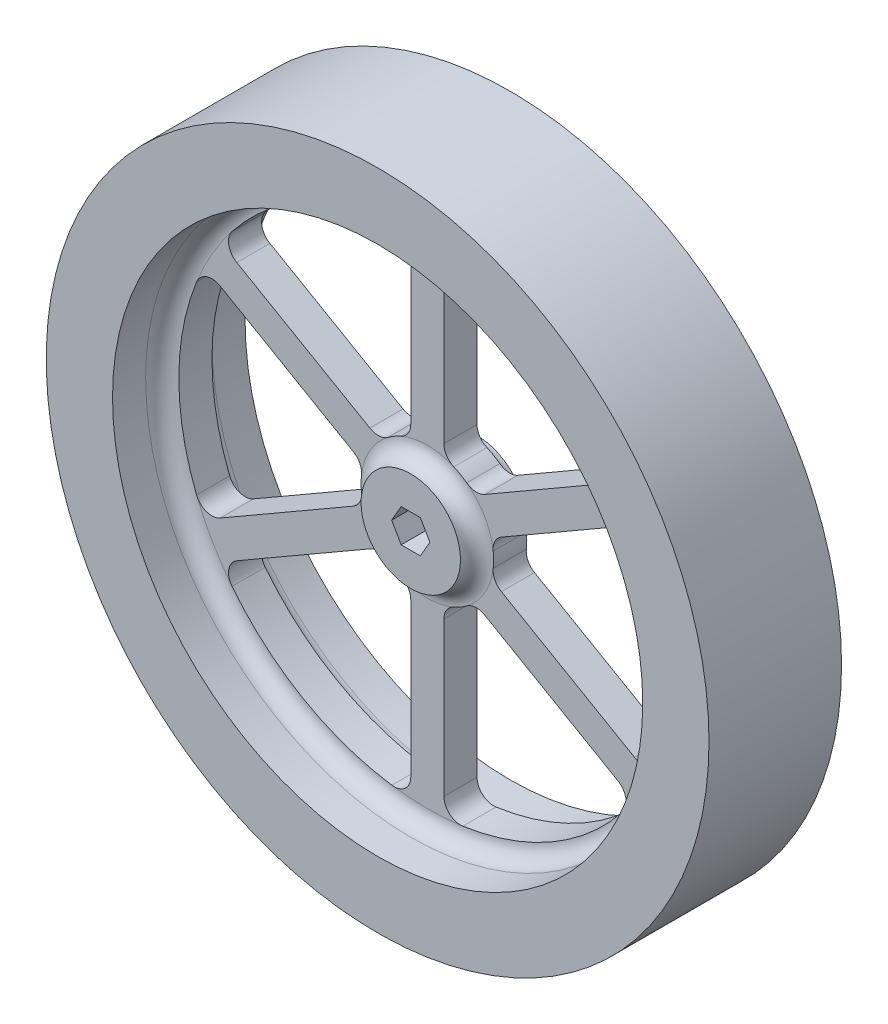
from build123d import *

# Parameters (mm, degrees)
BOSS_EXTRUDE1_DEPTH      = 25.4
BOSS_EXTRUDE1_DEPTH_BACK = 25.4
SKETCH1_R                = 127
SKETCH1_R_2              = 101.6
BOSS_EXTRUDE2_DEPTH      = 6.35
BOSS_EXTRUDE2_DEPTH_BACK = 6.35
SKETCH1_4_R              = 101.6
SKETCH1_4_R_2            = 95.25
SKETCH1_4_R_3            = 25.4
SKETCH1_4_R_4            = 19.05
BOSS_EXTRUDE3_DEPTH      = 12.7
BOSS_EXTRUDE3_DEPTH_BACK = 12.7
SKETCH1_5_R              = 19.05
BOSS_EXTRUDE4_DEPTH      = 6.35
FILLET1_R                = 6.35
CIRPATTERN2_START        = -6.35
CIRPATTERN2_DEPTH        = 12.7


with BuildPart() as part:
    # Sketch1 → Boss-Extrude1 (new, two sides: drawn at the far end of the back side and taken through both)
    with BuildSketch(Plane.XY.offset(-BOSS_EXTRUDE1_DEPTH_BACK)):
        Circle(SKETCH1_R)
        Circle(SKETCH1_R_2, mode=Mode.SUBTRACT)
    extrude(amount=BOSS_EXTRUDE1_DEPTH + BOSS_EXTRUDE1_DEPTH_BACK)

    # Sketch1<4> → Boss-Extrude2 (add, two sides: drawn at the far end of the back side and taken through both)
    # profile 1 of 2: a face of its own
    with BuildSketch(Plane.XY.offset(-BOSS_EXTRUDE2_DEPTH_BACK)):
        Circle(SKETCH1_4_R)
        Circle(SKETCH1_4_R_2, mode=Mode.SUBTRACT)
    # profile 2 of 2: a face of its own
    with BuildSketch(Plane.XY.offset(-BOSS_EXTRUDE2_DEPTH_BACK)):
        Circle(SKETCH1_4_R_3)
        Circle(SKETCH1_4_R_4, mode=Mode.SUBTRACT)
    extrude(amount=BOSS_EXTRUDE2_DEPTH + BOSS_EXTRUDE2_DEPTH_BACK)


with BuildPart() as boss_extrude2_piece_1:
    # of the separate pieces the step leaves, piece 1, a body of its own (boss_extrude2_pieces)
    add(part.part.solids().sort_by_distance((127, 0, 0))[0])



with BuildPart() as boss_extrude2_piece_2:
    # of the separate pieces the step leaves, piece 2, a body of its own (boss_extrude2_pieces)
    add(part.part.solids().sort_by_distance((25.4, 0, 0))[0])

    # Sketch1<5> → Boss-Extrude3 (add, two sides: drawn at the far end of the back side and taken through both)
    with BuildSketch(Plane.XY.offset(-BOSS_EXTRUDE3_DEPTH_BACK)):
        Circle(SKETCH1_5_R)
        Polygon((3.666174209, -6.35), (7.332348419, 0), (3.666174209, 6.35), (-3.666174209, 6.35), (-7.332348419, 0), (-3.666174209, -6.35), align=None, mode=Mode.SUBTRACT)
    extrude(amount=BOSS_EXTRUDE3_DEPTH + BOSS_EXTRUDE3_DEPTH_BACK)


with BuildPart() as boss_extrude2_piece_1_1:
    add(boss_extrude2_piece_1.part)

    add(boss_extrude2_piece_2.part)  # Boss-Extrude4 merges Boss-Extrude2 piece 2
    # Sketch1<6> → Boss-Extrude4 (add, symmetric)
    with BuildSketch(Plane.XY):
        with BuildLine():
            ThreePointArc((6.35, 95.038097624), (0, 95.25), (-6.35, 95.038097624))
            Line((-6.35, 95.038097624), (-6.35, 24.593444248))
            ThreePointArc((-6.35, 24.593444248), (0, 25.4), (6.35, 24.593444248))
            Line((6.35, 24.593444248), (6.35, 95.038097624))
        make_face()
    extrude(amount=BOSS_EXTRUDE4_DEPTH, both=True)

    # Fillet1
    fillet1_edges = [boss_extrude2_piece_1_1.edges().sort_by_distance(p)[0] for p in [
        (6.35, 95.038097624, 0),
        (6.35, 24.593444248, 0),
        (-6.35, 24.593444248, 0),
        (-6.35, 95.038097624, 0),
    ]]
    fillet(fillet1_edges, radius=FILLET1_R)

    # Fillet2: read off the stored shape, not the designer's step
    # Fillet2 outline → Fillet2 (revolve)
    with BuildSketch(Plane.XZ):
        with BuildLine():
            ThreePointArc((25.4, 6.35), (20.909871939, 8.209871939), (19.05, 12.7))
            Line((19.05, 12.7), (19.05, 6.35))
            Line((19.05, 6.35), (25.4, 6.35))
        make_face()
        with BuildLine():
            ThreePointArc((101.6, 12.7), (99.740128061, 8.209871939), (95.25, 6.35))
            Line((95.25, 6.35), (101.6, 6.35))
            Line((101.6, 6.35), (101.6, 12.7))
        make_face()
        with BuildLine():
            ThreePointArc((19.05, -12.7), (20.909871939, -8.209871939), (25.4, -6.35))
            Line((25.4, -6.35), (19.05, -6.35))
            Line((19.05, -6.35), (19.05, -12.7))
        make_face()
        with BuildLine():
            Line((101.6, -6.35), (95.25, -6.35))
            ThreePointArc((95.25, -6.35), (99.740128061, -8.209871939), (101.6, -12.7))
            Line((101.6, -12.7), (101.6, -6.35))
        make_face()
    revolve(axis=Axis((0, 0, 0), (0, 0, 1)))

    # CirPattern2: read off the stored shape, not the designer's step
    # CirPattern2 outline → CirPattern2 (add)
    with BuildSketch(Plane.XY.offset(CIRPATTERN2_START)):
        with BuildLine():
            ThreePointArc((13.607142857, -94.273051098), (8.542949191, -92.788329832), (6.35, -87.988181024))
            Line((6.35, -87.988181024), (6.35, -29.099355663))
            ThreePointArc((6.35, -29.099355663), (7.387208832, -25.621317423), (10.16, -23.27948453))
            ThreePointArc((10.16, -23.27948453), (0, -25.4), (-10.16, -23.27948453))
            ThreePointArc((-10.16, -23.27948453), (-7.387208832, -25.621317423), (-6.35, -29.099355663))
            Line((-6.35, -29.099355663), (-6.35, -87.988181024))
            ThreePointArc((-6.35, -87.988181024), (-8.542949191, -92.788329832), (-13.607142857, -94.273051098))
            ThreePointArc((-13.607142857, -94.273051098), (0, -95.25), (13.607142857, -94.273051098))
        make_face()
        with BuildLine():
            ThreePointArc((73.025, -49.493351826), (76.085576213, -53.792575939), (74.839285714, -58.920656936))
            ThreePointArc((74.839285714, -58.920656936), (82.48891971, -47.625), (88.446428571, -35.352394162))
            ThreePointArc((88.446428571, -35.352394162), (84.628525404, -38.995753893), (79.375, -38.494829198))
            Line((79.375, -38.494829198), (28.375781238, -9.050416517))
            ThreePointArc((28.375781238, -9.050416517), (25.882316182, -6.4131482), (25.24062499, -2.840924163))
            ThreePointArc((25.24062499, -2.840924163), (21.997045256, -12.7), (15.08062499, -20.438560368))
            ThreePointArc((15.08062499, -20.438560368), (18.495107351, -19.208169223), (22.025781238, -20.048939146))
            Line((22.025781238, -20.048939146), (73.025, -49.493351826))
        make_face()
        with BuildLine():
            ThreePointArc((-88.446428571, -35.352394162), (-82.48891971, -47.625), (-74.839285714, -58.920656936))
            ThreePointArc((-74.839285714, -58.920656936), (-76.085576213, -53.792575939), (-73.025, -49.493351826))
            Line((-73.025, -49.493351826), (-22.025781238, -20.048939146))
            ThreePointArc((-22.025781238, -20.048939146), (-18.495107351, -19.208169223), (-15.08062499, -20.438560368))
            ThreePointArc((-15.08062499, -20.438560368), (-21.997045256, -12.7), (-25.24062499, -2.840924163))
            ThreePointArc((-25.24062499, -2.840924163), (-25.882316182, -6.4131482), (-28.375781238, -9.050416517))
            Line((-28.375781238, -9.050416517), (-79.375, -38.494829198))
            ThreePointArc((-79.375, -38.494829198), (-84.628525404, -38.995753893), (-88.446428571, -35.352394162))
        make_face()
        with BuildLine():
            ThreePointArc((79.375, 38.494829198), (84.628525404, 38.995753893), (88.446428571, 35.352394162))
            ThreePointArc((88.446428571, 35.352394162), (82.488919711, 47.625), (74.839285714, 58.920656936))
            ThreePointArc((74.839285714, 58.920656936), (76.085576213, 53.792575939), (73.025, 49.493351826))
            Line((73.025, 49.493351826), (22.025781238, 20.048939146))
            ThreePointArc((22.025781238, 20.048939146), (18.495107351, 19.208169223), (15.08062499, 20.438560368))
            ThreePointArc((15.08062499, 20.438560368), (21.997045256, 12.7), (25.24062499, 2.840924163))
            ThreePointArc((25.24062499, 2.840924163), (25.882316182, 6.4131482), (28.375781238, 9.050416517))
            Line((28.375781238, 9.050416517), (79.375, 38.494829198))
        make_face()
        with BuildLine():
            ThreePointArc((-74.839285714, 58.920656936), (-82.488919711, 47.625), (-88.446428571, 35.352394162))
            ThreePointArc((-88.446428571, 35.352394162), (-84.628525404, 38.995753893), (-79.375, 38.494829198))
            Line((-79.375, 38.494829198), (-28.375781238, 9.050416517))
            ThreePointArc((-28.375781238, 9.050416517), (-25.882316182, 6.4131482), (-25.24062499, 2.840924163))
            ThreePointArc((-25.24062499, 2.840924163), (-21.997045256, 12.7), (-15.08062499, 20.438560368))
            ThreePointArc((-15.08062499, 20.438560368), (-18.495107351, 19.208169223), (-22.025781238, 20.048939146))
            Line((-22.025781238, 20.048939146), (-73.025, 49.493351826))
            ThreePointArc((-73.025, 49.493351826), (-76.085576213, 53.792575939), (-74.839285714, 58.920656936))
        make_face()
    extrude(amount=CIRPATTERN2_DEPTH)


solid = boss_extrude2_piece_1_1.part
